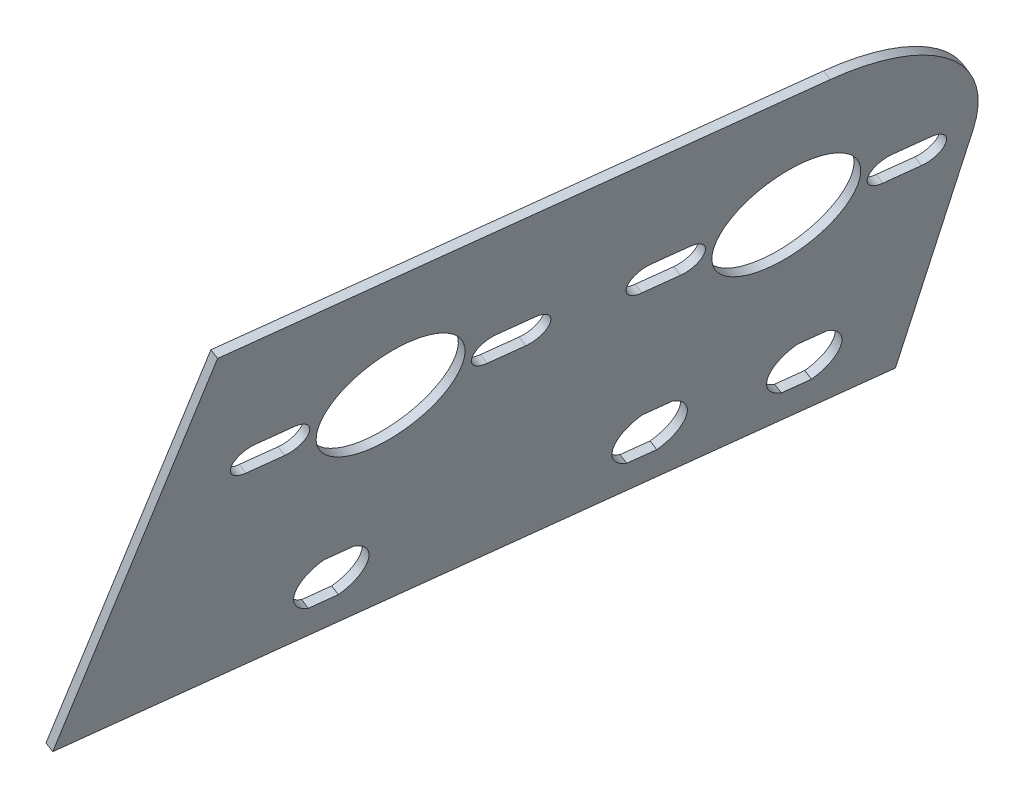
from build123d import *

# Parameters (mm, degrees)
SKETCH39_R          = 11.90625
BOSS_EXTRUDE1_DEPTH = 1.5875


with BuildPart() as part:
    # Sketch39 → Boss-Extrude1 (new body)
    with BuildSketch(Plane(origin=(-441.521969452, 172.104793819, -62.182961286), x_dir=(-0.1212218165913434, 0.04725213510134498, 0.9915001295565519), z_dir=(-0.9237984742451071, 0.36009566214142513, -0.1301056996804562))):
        with BuildLine():
            Line((-228.309977642, 213.517723768), (-90.363815922, 201.963804234))
            Line((-90.363815922, 201.963804234), (-90.363815922, 286.910203234))
            Line((-90.363815922, 286.910203234), (-190.676741831, 295.312085966))
            ThreePointArc((-190.676741831, 295.312085966), (-213.041445426, 288.169322029), (-223.80498218, 267.304391641))
            Line((-223.80498218, 267.304391641), (-228.309977642, 213.517723768))
        make_face()
        with Locations((-128.463815922, 259.318927244)):
            Circle(SKETCH39_R, mode=Mode.SUBTRACT)
        with Locations((-193.237014843, 264.74411863)):
            Circle(SKETCH39_R, mode=Mode.SUBTRACT)
        with BuildLine():
            Line((-211.342041249, 230.360271548), (-206.415245302, 229.947619226))
            ThreePointArc((-206.415245302, 229.947619226), (-203.328738088, 224.169845415), (-207.333354614, 218.986000947))
            Line((-207.333354614, 218.986000947), (-212.260150561, 219.398653269))
            ThreePointArc((-212.260150561, 219.398653269), (-215.346657775, 225.176427079), (-211.342041249, 230.360271548))
        make_face(mode=Mode.SUBTRACT)
        with BuildLine():
            Line((-186.030668133, 228.240273677), (-181.103872186, 227.827621356))
            ThreePointArc((-181.103872186, 227.827621356), (-178.017364976, 222.049847551), (-182.021981496, 216.866003088))
            Line((-182.021981496, 216.866003088), (-186.948777443, 217.27865541))
            ThreePointArc((-186.948777443, 217.27865541), (-190.035284653, 223.056429214), (-186.030668133, 228.240273677))
        make_face(mode=Mode.SUBTRACT)
        with BuildLine():
            Line((-215.859429659, 269.914226569), (-209.53158638, 269.384227103))
            ThreePointArc((-209.53158638, 269.384227103), (-206.55149466, 265.859295931), (-210.076425831, 262.879204212))
            Line((-210.076425831, 262.879204212), (-216.40426911, 263.409203678))
            ThreePointArc((-216.40426911, 263.409203678), (-219.38436083, 266.934134849), (-215.859429659, 269.914226569))
        make_face(mode=Mode.SUBTRACT)
        with BuildLine():
            Line((-170.614600027, 259.57401069), (-176.942443306, 260.104010157))
            ThreePointArc((-176.942443306, 260.104010157), (-179.922535026, 263.628941328), (-176.397603855, 266.609033048))
            Line((-176.397603855, 266.609033048), (-170.069760576, 266.079033581))
            ThreePointArc((-170.069760576, 266.079033581), (-167.089668856, 262.55410241), (-170.614600027, 259.57401069))
        make_face(mode=Mode.SUBTRACT)
        with BuildLine():
            Line((-151.086230738, 264.489035183), (-144.758387459, 263.959035717))
            ThreePointArc((-144.758387459, 263.959035717), (-141.778295739, 260.434104546), (-145.30322691, 257.454012826))
            Line((-145.30322691, 257.454012826), (-151.631070189, 257.984012292))
            ThreePointArc((-151.631070189, 257.984012292), (-154.611161909, 261.508943463), (-151.086230738, 264.489035183))
        make_face(mode=Mode.SUBTRACT)
        with BuildLine():
            Line((-105.841401106, 254.148819304), (-112.169244385, 254.678818771))
            ThreePointArc((-112.169244385, 254.678818771), (-115.149336105, 258.203749942), (-111.624404934, 261.183841662))
            Line((-111.624404934, 261.183841662), (-105.296561655, 260.653842195))
            ThreePointArc((-105.296561655, 260.653842195), (-102.316469935, 257.128911024), (-105.841401106, 254.148819304))
        make_face(mode=Mode.SUBTRACT)
        with BuildLine():
            Line((-133.91315577, 223.875081224), (-128.986359824, 223.462428902))
            ThreePointArc((-128.986359824, 223.462428902), (-125.899852614, 217.684655097), (-129.904469134, 212.500810634))
            Line((-129.904469134, 212.500810634), (-134.831265081, 212.913462956))
            ThreePointArc((-134.831265081, 212.913462956), (-137.917772291, 218.691236761), (-133.91315577, 223.875081224))
        make_face(mode=Mode.SUBTRACT)
    extrude(amount=BOSS_EXTRUDE1_DEPTH)


solid = part.part
